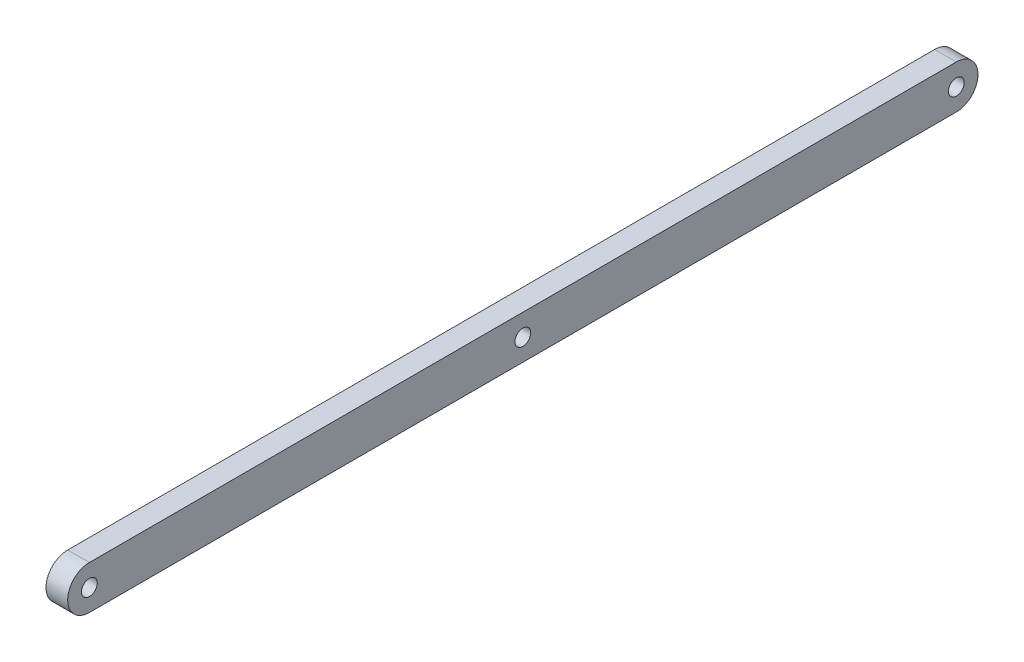
from build123d import *

# Parameters (mm, degrees)
SKETCH1_R           = 1.8288
BOSS_EXTRUDE1_DEPTH = 5


with BuildPart() as part:
    # Sketch1 → Boss-Extrude1 (new body)
    with BuildSketch(Plane(origin=(0, 0, 0), x_dir=(0, 0, -1), z_dir=(1, 0, 0))):
        with BuildLine():
            Line((100, 5), (-100, 5))
            ThreePointArc((-100, 5), (-105, 0), (-100, -5))
            Line((-100, -5), (100, -5))
            ThreePointArc((100, -5), (105, 0), (100, 5))
        make_face()
        with Locations((-100, 0)):
            Circle(SKETCH1_R, mode=Mode.SUBTRACT)
        Circle(SKETCH1_R, mode=Mode.SUBTRACT)
        with Locations((100, 0)):
            Circle(SKETCH1_R, mode=Mode.SUBTRACT)
    extrude(amount=BOSS_EXTRUDE1_DEPTH)


solid = part.part
